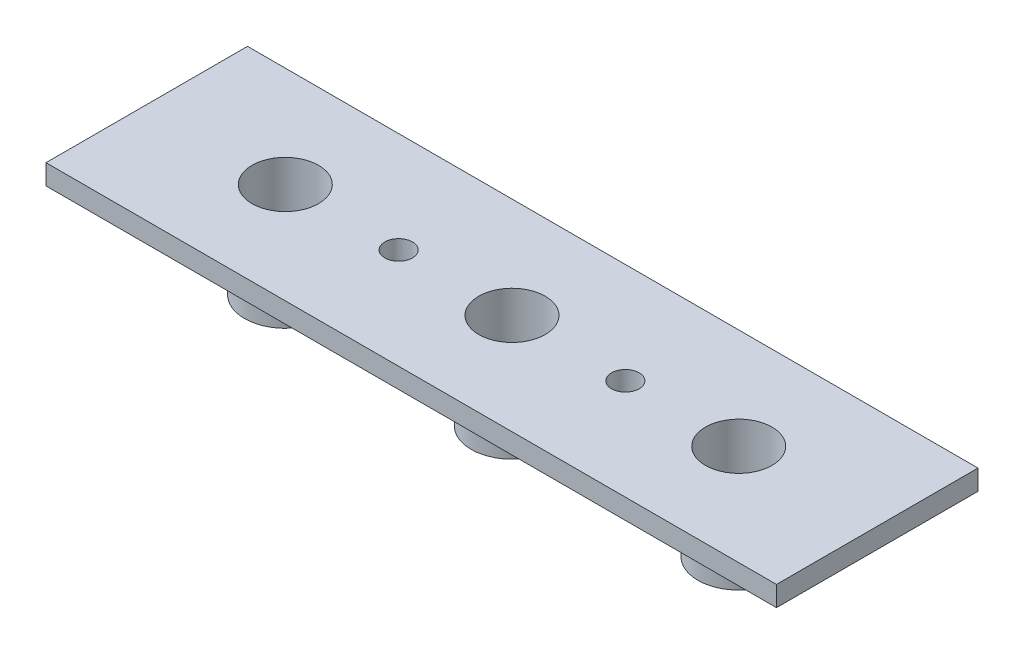
from build123d import *

# Parameters (mm, degrees)
SKETCH2_W           = 145
SKETCH2_H           = 40
SKETCH2_R           = 6.6
BOSS_EXTRUDE3_DEPTH = 4
BOSS_EXTRUDE4_START = -15
SKETCH2_5_R         = 8.1
SKETCH2_5_R_2       = 6.6
BOSS_EXTRUDE4_DEPTH = 15
SKETCH3_R           = 2.75
CUT_EXTRUDE1_DEPTH  = 74


with BuildPart() as part:
    # Sketch2 → Boss-Extrude3 (new body)
    with BuildSketch(Plane(origin=(0, 0, 0), x_dir=(1, 0, 0), z_dir=(0, 1, 0))):
        with Locations((45, 0)):
            Rectangle(SKETCH2_W, SKETCH2_H)
        with Locations((45, 0)):
            Circle(SKETCH2_R, mode=Mode.SUBTRACT)
        Circle(SKETCH2_R, mode=Mode.SUBTRACT)
        with Locations((90, 0)):
            Circle(SKETCH2_R, mode=Mode.SUBTRACT)
    extrude(amount=BOSS_EXTRUDE3_DEPTH)

    # Sketch2<5> → Boss-Extrude4 (add)
    # profile 1 of 3: a face of its own
    with BuildSketch(Plane(origin=(0, 0, 0), x_dir=(1, 0, 0), z_dir=(0, 1, 0)).offset(BOSS_EXTRUDE4_START)):
        with Locations((45, 0)):
            Circle(SKETCH2_5_R)
        with Locations((45, 0)):
            Circle(SKETCH2_5_R_2, mode=Mode.SUBTRACT)
    # profile 2 of 3: a face of its own
    with BuildSketch(Plane(origin=(0, 0, 0), x_dir=(1, 0, 0), z_dir=(0, 1, 0)).offset(BOSS_EXTRUDE4_START)):
        Circle(SKETCH2_5_R)
        Circle(SKETCH2_5_R_2, mode=Mode.SUBTRACT)
    # profile 3 of 3: a face of its own
    with BuildSketch(Plane(origin=(0, 0, 0), x_dir=(1, 0, 0), z_dir=(0, 1, 0)).offset(BOSS_EXTRUDE4_START)):
        with Locations((90, 0)):
            Circle(SKETCH2_5_R)
        with Locations((90, 0)):
            Circle(SKETCH2_5_R_2, mode=Mode.SUBTRACT)
    extrude(amount=BOSS_EXTRUDE4_DEPTH)

    # Sketch3 → Cut-Extrude1 (cut)
    with BuildSketch(Plane.XZ):
        with Locations((22.5, 0)):
            Circle(SKETCH3_R)
        with Locations((67.5, 0)):
            Circle(SKETCH3_R)
    extrude(amount=-CUT_EXTRUDE1_DEPTH, mode=Mode.SUBTRACT)


solid = part.part
